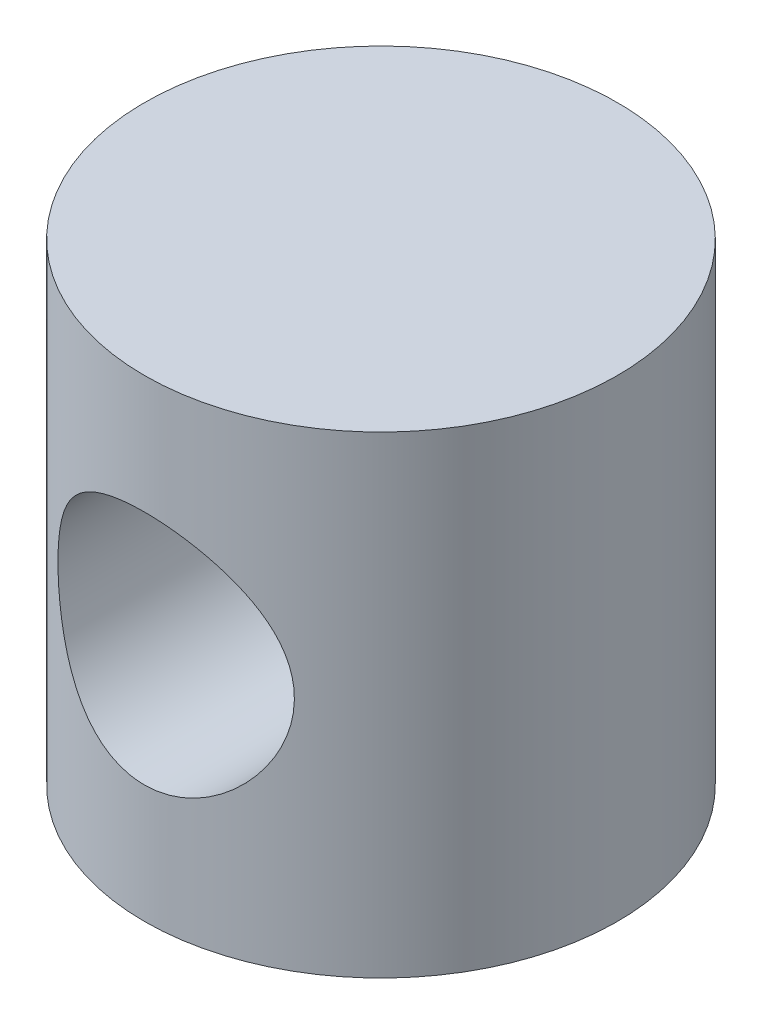
from build123d import *

# Parameters (mm, degrees)
SKETCH1_R           = 5
BOSS_EXTRUDE1_DEPTH = 10
SKETCH2_R           = 2.5
CUT_EXTRUDE1_DEPTH  = 13.247448714


with BuildPart() as part:
    # Sketch1 → Boss-Extrude1 (new body)
    with BuildSketch(Plane(origin=(0, 0, 0), x_dir=(1, 0, 0), z_dir=(0, 1, 0))):
        Circle(SKETCH1_R)
    extrude(amount=BOSS_EXTRUDE1_DEPTH)

    # Sketch2 → Cut-Extrude1 (cut, through all)
    with BuildSketch(Plane.XY):
        with Locations((0, 5)):
            Circle(SKETCH2_R)
    extrude(amount=CUT_EXTRUDE1_DEPTH, mode=Mode.SUBTRACT)


solid = part.part
